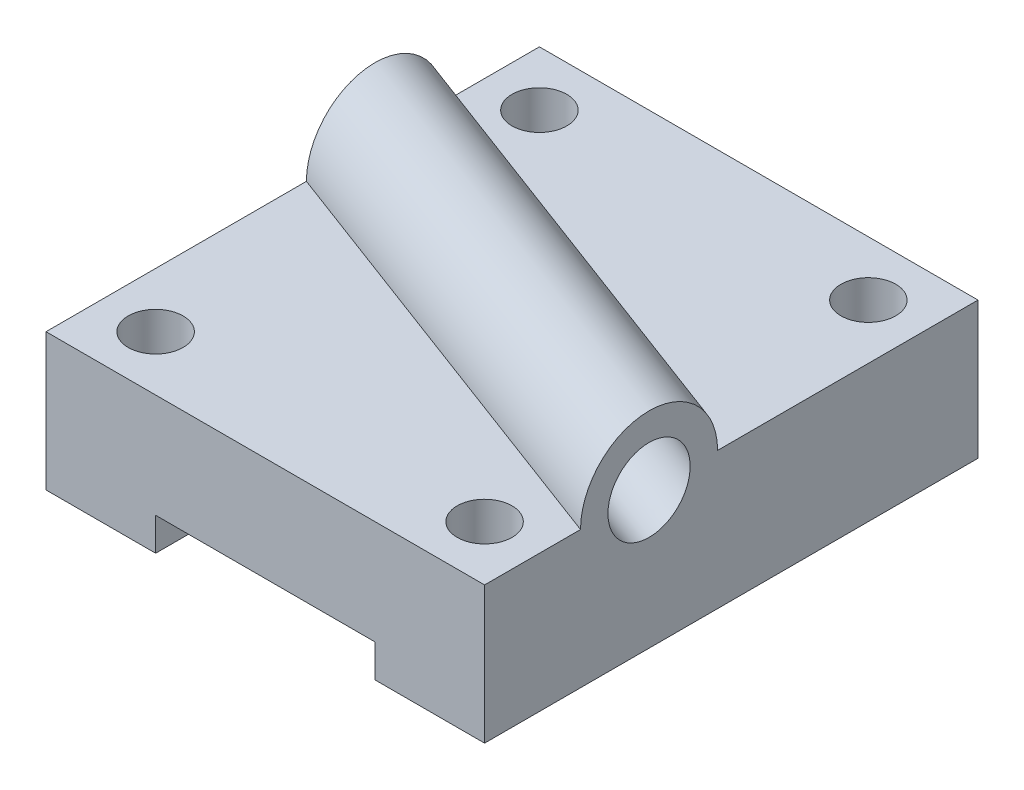
from build123d import *

# Parameters (mm, degrees)
SALIENTE_EXTRUIR1_DEPTH = 90
CORTAR_EXTRUIR1_REACH   = 103.612
CROQUIS13_R             = 5


with BuildPart() as part:
    # Croquis1 → Saliente-Extruir1 (new body)
    with BuildSketch(Plane.XY):
        Polygon((-20, 0), (-20, 6), (20, 6), (20, 0), (40, 0), (40, 25), (-40, 25), (-40, 0), align=None)
    extrude(amount=-SALIENTE_EXTRUIR1_DEPTH)

    # Croquis7 → Recubrir5 section 0
    with BuildSketch(Plane.ZY.offset(40)):
        with BuildLine():
            Line((-72.5, 25), (-47.5, 25))
            ThreePointArc((-47.5, 25), (-60, 37.5), (-72.5, 25))
        make_face()
    # Croquis4 → Recubrir5 section 1
    with BuildSketch(Plane(origin=(40, 0, 0), x_dir=(0, 0, -1), z_dir=(1, 0, 0))):
        with BuildLine():
            Line((17.5, 25), (42.5, 25))
            ThreePointArc((42.5, 25), (30, 37.5), (17.5, 25))
        make_face()
    loft()

    # Cortar-Recubrir9: read off the stored shape, not the designer's step
    # Cortar-Recubrir9: loft between two sections, ruled curve by curve
    cortar_recubrir9_from = [
        Edge.make_bspline([(40, 32.499166066, -30.111840594), (40, 32.489846016, -30.7367711), (40, 32.403311627, -31.442559169), (40, 32.050170272, -32.589420619), (40, 31.894761884, -32.985674675), (40, 31.488867377, -33.787689912), (40, 31.23815997, -34.193490215), (40, 30.626297022, -34.984454015), (40, 30.264857287, -35.369499204), (40, 29.428532809, -36.077692088), (40, 28.953437789, -36.400496106), (40, 27.907235106, -36.938588098), (40, 27.33619148, -37.153384345), (40, 26.13890697, -37.438520628), (40, 25.513089911, -37.508486115), (40, 24.2632289, -37.489846016), (40, 23.639776598, -37.401249254), (40, 22.451527572, -37.08053575), (40, 21.887143317, -36.84880603), (40, 20.857452279, -36.279754704), (40, 20.392194841, -35.942926515), (40, 19.577361218, -35.210108693), (40, 19.227564602, -34.814456311), (40, 18.63956098, -34.005598017), (40, 18.40106638, -33.592501883), (40, 18.019269161, -32.778739219), (40, 17.875746519, -32.378026983), (40, 17.556962594, -31.221144617), (40, 17.491513885, -30.513089911), (40, 17.510153984, -29.2632289), (40, 17.596688373, -28.557440831), (40, 17.949829728, -27.410579381), (40, 18.105238116, -27.014325325), (40, 18.511132623, -26.212310088), (40, 18.76184003, -25.806509785), (40, 19.373702978, -25.015545985), (40, 19.735142713, -24.630500796), (40, 20.571467191, -23.922307912), (40, 21.046562211, -23.599503894), (40, 22.092764894, -23.061411902), (40, 22.66380852, -22.846615655), (40, 23.86109303, -22.561479372), (40, 24.486910089, -22.491513885), (40, 25.7367711, -22.510153984), (40, 26.360223402, -22.598750746), (40, 27.548472428, -22.91946425), (40, 28.112856683, -23.15119397), (40, 29.142547721, -23.720245296), (40, 29.607805159, -24.057073485), (40, 30.422638782, -24.789891307), (40, 30.772435398, -25.185543689), (40, 31.36043902, -25.994401983), (40, 31.59893362, -26.407498117), (40, 31.980730839, -27.221260781), (40, 32.124253481, -27.621973017), (40, 32.443037406, -28.778855383), (40, 32.508486115, -29.486910089), (40, 32.499166066, -30.111840594)], [0, 0, 0, 0, 0.0625, 0.0625, 0.09375, 0.09375, 0.125, 0.125, 0.15625, 0.15625, 0.1875, 0.1875, 0.21875, 0.21875, 0.25, 0.25, 0.28125, 0.28125, 0.3125, 0.3125, 0.34375, 0.34375, 0.375, 0.375, 0.40625, 0.40625, 0.4375, 0.4375, 0.5, 0.5, 0.5625, 0.5625, 0.59375, 0.59375, 0.625, 0.625, 0.65625, 0.65625, 0.6875, 0.6875, 0.71875, 0.71875, 0.75, 0.75, 0.78125, 0.78125, 0.8125, 0.8125, 0.84375, 0.84375, 0.875, 0.875, 0.90625, 0.90625, 0.9375, 0.9375, 1, 1, 1, 1], 3),
    ]
    cortar_recubrir9_to = [
        Edge.make_bspline([(-40, 32.407786034, -58.827521395), (-40, 32.505492584, -59.444836898), (-40, 32.540952669, -60.155025311), (-40, 32.389176568, -61.345388288), (-40, 32.303834333, -61.762384388), (-40, 32.041099336, -62.622005881), (-40, 31.863495239, -63.064707671), (-40, 31.395936741, -63.948669802), (-40, 31.105682099, -64.38986219), (-40, 30.4028125, -65.230665449), (-40, 29.989931581, -65.629973674), (-40, 29.051182223, -66.33908064), (-40, 28.525292772, -66.648383946), (-40, 27.394421955, -67.134104129), (-40, 26.789794107, -67.310079483), (-40, 25.555163102, -67.505492584), (-40, 24.925744385, -67.524837827), (-40, 23.700150248, -67.41209072), (-40, 23.104447414, -67.280309139), (-40, 21.992598562, -66.895763725), (-40, 21.476585556, -66.643477599), (-40, 20.548417009, -66.060829384), (-40, 20.136101969, -65.730837282), (-40, 19.418414702, -65.034471726), (-40, 19.112777895, -64.668255626), (-40, 18.597419473, -63.931788052), (-40, 18.38747326, -63.561529181), (-40, 17.875511732, -62.476220288), (-40, 17.689920517, -61.789794107), (-40, 17.494507416, -60.555163102), (-40, 17.459047331, -59.844974689), (-40, 17.610823432, -58.654611712), (-40, 17.696165667, -58.237615612), (-40, 17.958900664, -57.377994119), (-40, 18.136504761, -56.935292329), (-40, 18.604063259, -56.051330198), (-40, 18.894317901, -55.61013781), (-40, 19.5971875, -54.769334551), (-40, 20.010068419, -54.370026326), (-40, 20.948817777, -53.66091936), (-40, 21.474707228, -53.351616054), (-40, 22.605578045, -52.865895871), (-40, 23.210205893, -52.689920517), (-40, 24.444836898, -52.494507416), (-40, 25.074255615, -52.475162173), (-40, 26.299849752, -52.58790928), (-40, 26.895552586, -52.719690861), (-40, 28.007401438, -53.104236275), (-40, 28.523414444, -53.356522401), (-40, 29.451582991, -53.939170616), (-40, 29.863898031, -54.269162718), (-40, 30.581585298, -54.965528274), (-40, 30.887222105, -55.331744374), (-40, 31.402580527, -56.068211948), (-40, 31.61252674, -56.438470819), (-40, 32.124488268, -57.523779712), (-40, 32.310079483, -58.210205893), (-40, 32.407786034, -58.827521395)], [0, 0, 0, 0, 0.0625, 0.0625, 0.09375, 0.09375, 0.125, 0.125, 0.15625, 0.15625, 0.1875, 0.1875, 0.21875, 0.21875, 0.25, 0.25, 0.28125, 0.28125, 0.3125, 0.3125, 0.34375, 0.34375, 0.375, 0.375, 0.40625, 0.40625, 0.4375, 0.4375, 0.5, 0.5, 0.5625, 0.5625, 0.59375, 0.59375, 0.625, 0.625, 0.65625, 0.65625, 0.6875, 0.6875, 0.71875, 0.71875, 0.75, 0.75, 0.78125, 0.78125, 0.8125, 0.8125, 0.84375, 0.84375, 0.875, 0.875, 0.90625, 0.90625, 0.9375, 0.9375, 1, 1, 1, 1], 3),
    ]
    cortar_recubrir9 = Solid(Shell([*[Face.make_surface_from_curves(cortar_recubrir9_from[k], cortar_recubrir9_to[k]) for k in range(1)], Face(Wire(cortar_recubrir9_from)), Face(Wire(cortar_recubrir9_to))]))
    add(cortar_recubrir9, mode=Mode.SUBTRACT)

    # Croquis13 → Cortar-Extruir1 (cut, up to next)
    with BuildSketch(Plane(origin=(0, 25, 0), x_dir=(1, 0, 0), z_dir=(0, 1, 0)), mode=Mode.PRIVATE) as cortar_extruir1_sk1:
        with Locations(Location((-30, 80, 0), (0, 0, 270))):
            Circle(CROQUIS13_R)
    cortar_extruir1_tool1 = extrude(cortar_extruir1_sk1.sketch, amount=-CORTAR_EXTRUIR1_REACH, mode=Mode.PRIVATE) & part.part
    # Croquis13 → Cortar-Extruir1 (cut, up to next)
    with BuildSketch(Plane(origin=(0, 25, 0), x_dir=(1, 0, 0), z_dir=(0, 1, 0)), mode=Mode.PRIVATE) as cortar_extruir1_sk2:
        with Locations((30, 80)):
            Circle(CROQUIS13_R)
    cortar_extruir1_tool2 = extrude(cortar_extruir1_sk2.sketch, amount=-CORTAR_EXTRUIR1_REACH, mode=Mode.PRIVATE) & part.part
    # Croquis13 → Cortar-Extruir1 (cut, up to next)
    with BuildSketch(Plane(origin=(0, 25, 0), x_dir=(1, 0, 0), z_dir=(0, 1, 0)), mode=Mode.PRIVATE) as cortar_extruir1_sk3:
        with Locations(Location((30, 10, 0), (0, 0, 270))):
            Circle(CROQUIS13_R)
    cortar_extruir1_tool3 = extrude(cortar_extruir1_sk3.sketch, amount=-CORTAR_EXTRUIR1_REACH, mode=Mode.PRIVATE) & part.part
    # Croquis13 → Cortar-Extruir1 (cut, up to next)
    with BuildSketch(Plane(origin=(0, 25, 0), x_dir=(1, 0, 0), z_dir=(0, 1, 0)), mode=Mode.PRIVATE) as cortar_extruir1_sk4:
        with Locations(Location((-30, 10, 0), (0, 0, 90))):
            Circle(CROQUIS13_R)
    cortar_extruir1_tool4 = extrude(cortar_extruir1_sk4.sketch, amount=-CORTAR_EXTRUIR1_REACH, mode=Mode.PRIVATE) & part.part
    add(cortar_extruir1_tool1.solids().sort_by_distance((-30, 25, -80))[0], mode=Mode.SUBTRACT)
    add(cortar_extruir1_tool2.solids().sort_by_distance((30, 25, -80))[0], mode=Mode.SUBTRACT)
    add(cortar_extruir1_tool3.solids().sort_by_distance((30, 25, -10))[0], mode=Mode.SUBTRACT)
    add(cortar_extruir1_tool4.solids().sort_by_distance((-30, 25, -10))[0], mode=Mode.SUBTRACT)


solid = part.part
